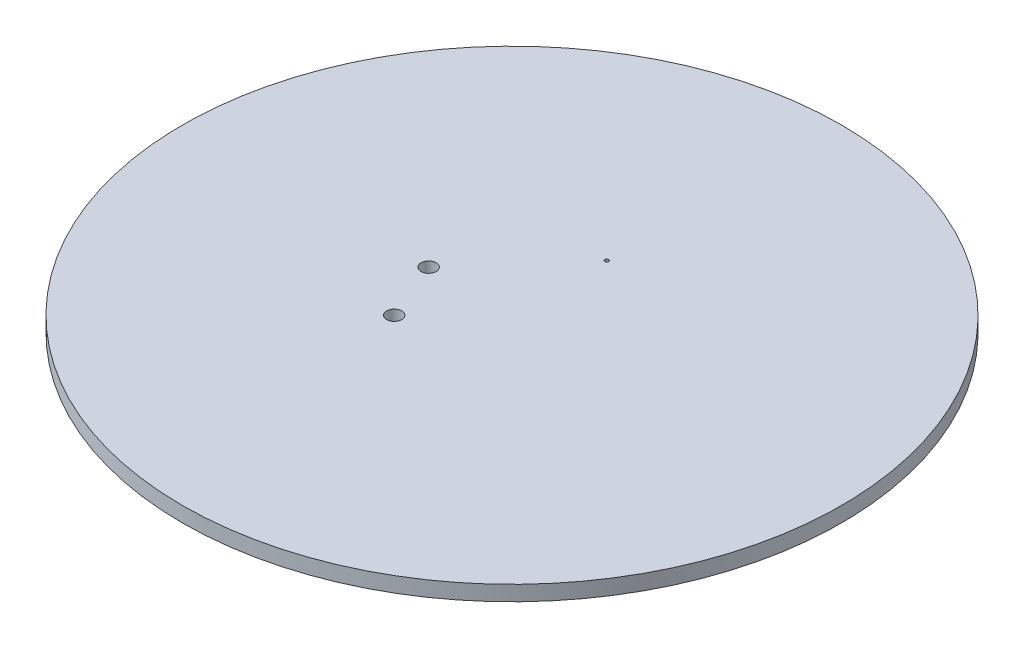
from build123d import *

# Parameters (mm, degrees)
SKETCH1_R               = 43.5
BOSS_EXTRUDE1_DEPTH     = 2
CUT_EXTRUDE1_DEPTH      = 62.550792034
CUT_EXTRUDE1_DEPTH_BACK = 62.550792034
SKETCH2_R               = 0.25
CUT_EXTRUDE2_DEPTH      = 62.550792034
CUT_EXTRUDE2_DEPTH_BACK = 62.550792034
SKETCH3_R               = 1


with BuildPart() as part:
    # Sketch1 → Boss-Extrude1 (new body)
    with BuildSketch(Plane(origin=(0, 0, 0), x_dir=(1, 0, 0), z_dir=(0, 1, 0))):
        Circle(SKETCH1_R)
    extrude(amount=BOSS_EXTRUDE1_DEPTH)

    # Sketch2 → Cut-Extrude1 (cut, two sides: drawn at the far end of the back side and taken through both)
    with BuildSketch(Plane(origin=(0, 2, 0), x_dir=(1, 0, 0), z_dir=(0, 1, 0)).offset(-CUT_EXTRUDE1_DEPTH_BACK)):
        with Locations((0, 12.5)):
            Circle(SKETCH2_R)
    extrude(amount=CUT_EXTRUDE1_DEPTH + CUT_EXTRUDE1_DEPTH_BACK, mode=Mode.SUBTRACT)

    # Sketch3 → Cut-Extrude2 (cut, two sides: drawn at the far end of the back side and taken through both)
    with BuildSketch(Plane(origin=(0, 2, 0), x_dir=(1, 0, 0), z_dir=(0, 1, 0)).offset(-CUT_EXTRUDE2_DEPTH_BACK)):
        with Locations((-11, 0)):
            Circle(SKETCH3_R)
        with Locations((-7.778174593, -7.778174593)):
            Circle(SKETCH3_R)
    extrude(amount=CUT_EXTRUDE2_DEPTH + CUT_EXTRUDE2_DEPTH_BACK, mode=Mode.SUBTRACT)


solid = part.part
